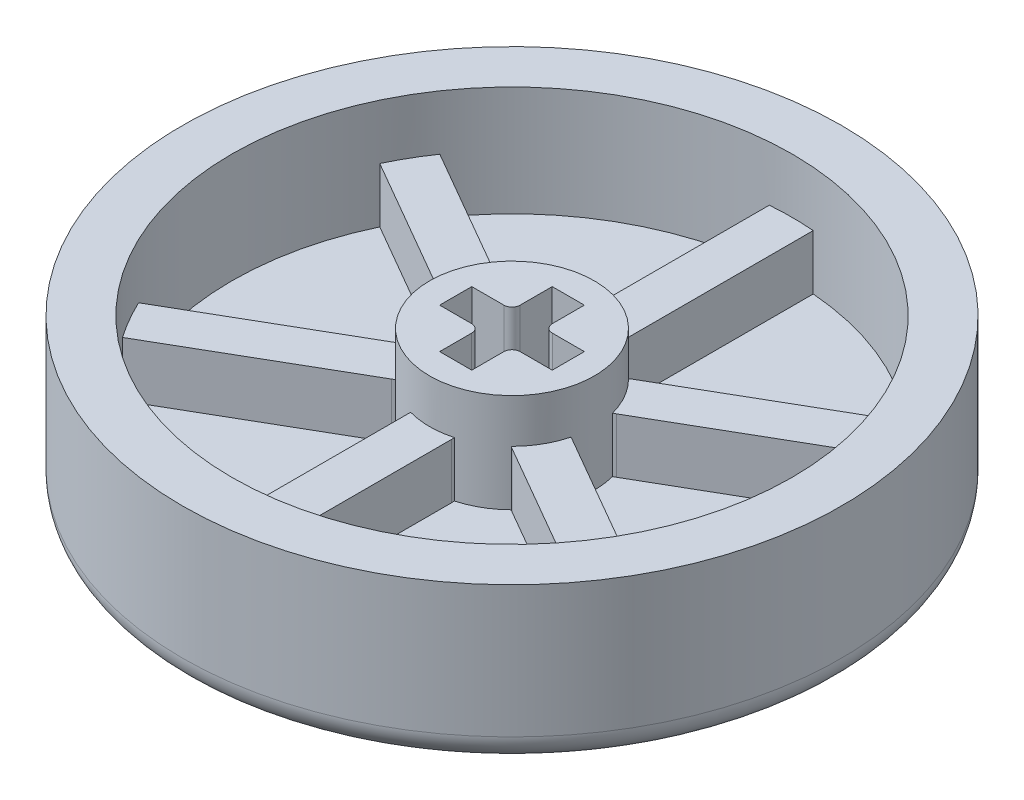
from build123d import *

# Parameters (mm, degrees)
SKETCH1_R           = 12
BUTTON_TOP_DEPTH    = 1.8
SKETCH2_R           = 12
SKETCH2_R_2         = 10.2
BUTTON_WALLS_DEPTH  = 4
SKETCH3_R           = 3
STEM_HOUSING_DEPTH  = 3.6
BOSS_EXTRUDE4_DEPTH = 2
FILLET1_R           = 1


with BuildPart() as part:
    # Sketch1 → button top (new body)
    with BuildSketch(Plane(origin=(0, 0, 0), x_dir=(1, 0, 0), z_dir=(0, 1, 0))):
        Circle(SKETCH1_R)
    extrude(amount=BUTTON_TOP_DEPTH)

    # Sketch2 → button walls (add)
    with BuildSketch(Plane(origin=(0, 1.8, 0), x_dir=(1, 0, 0), z_dir=(0, 1, 0))):
        Circle(SKETCH2_R)
        Circle(SKETCH2_R_2, mode=Mode.SUBTRACT)
    extrude(amount=BUTTON_WALLS_DEPTH)

    # Sketch3 → stem housing (add)
    with BuildSketch(Plane(origin=(0, 1.8, 0), x_dir=(1, 0, 0), z_dir=(0, 1, 0))):
        Circle(SKETCH3_R)
        with BuildLine():
            Line((-0.585, 0.885), (-0.585, 2.05))
            Line((-0.585, 2.05), (0.585, 2.05))
            Line((0.585, 2.05), (0.585, 0.885))
            ThreePointArc((0.585, 0.885), (0.672867966, 0.672867966), (0.885, 0.585))
            Line((0.885, 0.585), (2.05, 0.585))
            Line((2.05, 0.585), (2.05, -0.585))
            Line((2.05, -0.585), (0.885, -0.585))
            ThreePointArc((0.885, -0.585), (0.672867966, -0.672867966), (0.585, -0.885))
            Line((0.585, -0.885), (0.585, -2.05))
            Line((0.585, -2.05), (-0.585, -2.05))
            Line((-0.585, -2.05), (-0.585, -0.885))
            ThreePointArc((-0.585, -0.885), (-0.672867966, -0.672867966), (-0.885, -0.585))
            Line((-0.885, -0.585), (-2.05, -0.585))
            Line((-2.05, -0.585), (-2.05, 0.585))
            Line((-2.05, 0.585), (-0.885, 0.585))
            ThreePointArc((-0.885, 0.585), (-0.672867966, 0.672867966), (-0.585, 0.885))
        make_face(mode=Mode.SUBTRACT)
    extrude(amount=STEM_HOUSING_DEPTH)

    # Sketch4 → Boss-Extrude4 (add)
    with BuildSketch(Plane(origin=(0, 1.8, 0), x_dir=(1, 0, 0), z_dir=(0, 1, 0))):
        with BuildLine():
            Line((-0.8, 3), (-0.8, 10.2))
            ThreePointArc((-0.8, 10.2), (0, 11), (0.8, 10.2))
            Line((0.8, 10.2), (0.8, 3))
            ThreePointArc((0.8, 3), (0, 2.2), (-0.8, 3))
        make_face()
        with BuildLine():
            Line((2.198076211, 2.192820323), (8.433459119, 5.792820323))
            ThreePointArc((8.433459119, 5.792820323), (9.526279442, 5.5), (9.233459119, 4.407179677))
            Line((9.233459119, 4.407179677), (2.998076211, 0.807179677))
            ThreePointArc((2.998076211, 0.807179677), (1.905255888, 1.1), (2.198076211, 2.192820323))
        make_face()
        with BuildLine():
            Line((2.998076211, -0.807179677), (9.233459119, -4.407179677))
            ThreePointArc((9.233459119, -4.407179677), (9.526279442, -5.5), (8.433459119, -5.792820323))
            Line((8.433459119, -5.792820323), (2.198076211, -2.192820323))
            ThreePointArc((2.198076211, -2.192820323), (1.905255888, -1.1), (2.998076211, -0.807179677))
        make_face()
        with BuildLine():
            Line((0.8, -3), (0.8, -10.2))
            ThreePointArc((0.8, -10.2), (0, -11), (-0.8, -10.2))
            Line((-0.8, -10.2), (-0.8, -3))
            ThreePointArc((-0.8, -3), (0, -2.2), (0.8, -3))
        make_face()
        with BuildLine():
            Line((-2.198076211, -2.192820323), (-8.433459119, -5.792820323))
            ThreePointArc((-8.433459119, -5.792820323), (-9.526279442, -5.5), (-9.233459119, -4.407179677))
            Line((-9.233459119, -4.407179677), (-2.998076211, -0.807179677))
            ThreePointArc((-2.998076211, -0.807179677), (-1.905255888, -1.1), (-2.198076211, -2.192820323))
        make_face()
        with BuildLine():
            Line((-2.998076211, 0.807179677), (-9.233459119, 4.407179677))
            ThreePointArc((-9.233459119, 4.407179677), (-9.526279442, 5.5), (-8.433459119, 5.792820323))
            Line((-8.433459119, 5.792820323), (-2.198076211, 2.192820323))
            ThreePointArc((-2.198076211, 2.192820323), (-1.905255888, 1.1), (-2.998076211, 0.807179677))
        make_face()
    extrude(amount=BOSS_EXTRUDE4_DEPTH)

    # Fillet1
    fillet1_edges = [part.edges().sort_by_distance(p)[0] for p in [
        (-12, 0, 0),
    ]]
    fillet(fillet1_edges, radius=FILLET1_R)


solid = part.part
